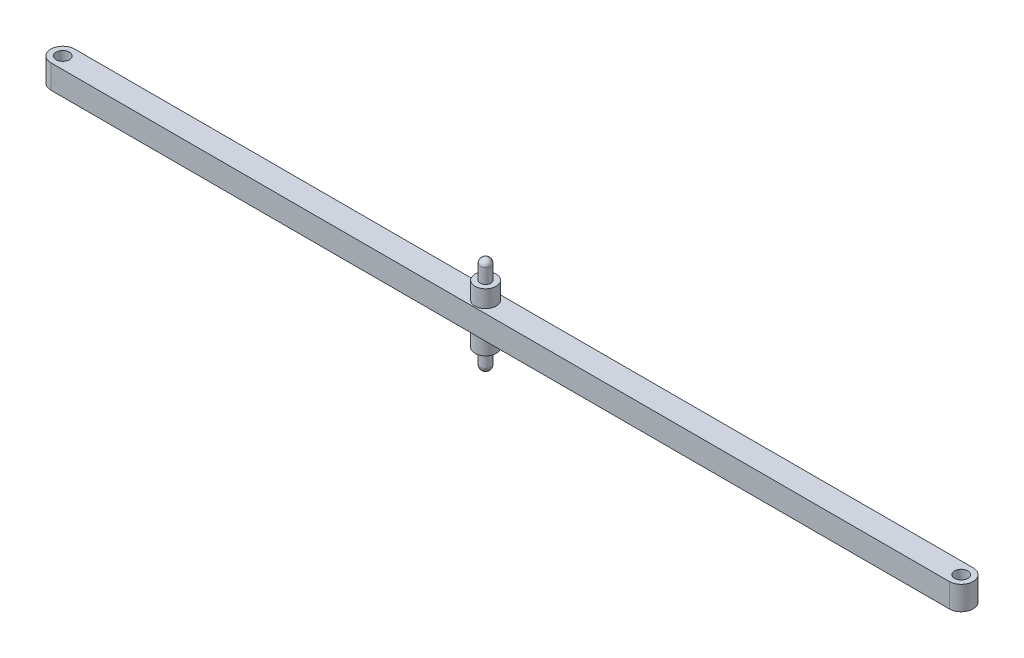
from build123d import *

# Parameters (mm, degrees)
BOSS_EXTRUDE1_DEPTH          = 9
SKETCH2_R                    = 4
BOSS_EXTRUDE2_DEPTH          = 6.5
BOSS_EXTRUDE4_START          = 6.5
SKETCH4_R                    = 4
BOSS_EXTRUDE4_DEPTH          = 6.5
F_5_0_5_DIAMETER_HOLE1_D     = 5
F_5_0_5_DIAMETER_HOLE1_DEPTH = 23


# Read off the part's stored shape, not the designer's step: Boss-Extrude3, Boss-Extrude5
with BuildPart() as part:
    # Sketch1 → Boss-Extrude1 (new body)
    with BuildSketch(Plane(origin=(0, 4.5, 0), x_dir=(1, 0, 0), z_dir=(0, 1, 0))):
        with BuildLine():
            Line((-170, -43.5), (170, -43.5))
            ThreePointArc((170, -43.5), (174.5, -39), (170, -34.5))
            Line((170, -34.5), (-170, -34.5))
            ThreePointArc((-170, -34.5), (-174.5, -39), (-170, -43.5))
        make_face()
    extrude(amount=-BOSS_EXTRUDE1_DEPTH)

    # Sketch2 → Boss-Extrude2 (add)
    with BuildSketch(Plane.XZ.offset(4.5)):
        with Locations(Location((-10, 39, 0), (0, 0, 90))):
            Circle(SKETCH2_R)
    extrude(amount=BOSS_EXTRUDE2_DEPTH)

    # Boss-Extrude3 outline → Boss-Extrude3 (revolve)
    with BuildSketch(Plane(origin=(-10, 0, 39), x_dir=(1, 0, 0), z_dir=(0, 0, 1))):
        with BuildLine():
            ThreePointArc((0, -18.5), (1.414213563, -17.914213562), (2, -16.499999998))
            Line((2, -16.499999998), (2, -11))
            Line((2, -11), (0, -11))
            Line((0, -11), (0, -18.5))
        make_face()
    revolve(axis=Axis((-10, 0, 39), (0, 1, 0)))

    # Sketch4 → Boss-Extrude4 (add)
    with BuildSketch(Plane(origin=(0, 4.5, 0), x_dir=(-1, 0, 0), z_dir=(0, 1, 0)).offset(BOSS_EXTRUDE4_START)):
        with Locations(Location((10, 39, 0), (0, 0, 90))):
            Circle(SKETCH4_R)
    extrude(amount=-BOSS_EXTRUDE4_DEPTH)

    # Boss-Extrude5 outline → Boss-Extrude5 (revolve)
    with BuildSketch(Plane(origin=(-10, 0, 39), x_dir=(1, 0, 0), z_dir=(0, 0, 1))):
        with BuildLine():
            Line((2, 11), (2, 16.499999998))
            ThreePointArc((2, 16.499999998), (1.414213563, 17.914213562), (0, 18.5))
            Line((0, 18.5), (0, 11))
            Line((0, 11), (2, 11))
        make_face()
    revolve(axis=Axis((-10, 0, 39), (0, 1, 0)))

    # Ø5.0 (5) Diameter Hole1
    with Locations(Plane(origin=(0, 4.5, 0), x_dir=(1, 0, 0), z_dir=(0, 1, 0))):
        with Locations((-170, -39), (170, -39)):
            Hole(F_5_0_5_DIAMETER_HOLE1_D / 2, depth=F_5_0_5_DIAMETER_HOLE1_DEPTH)


solid = part.part
